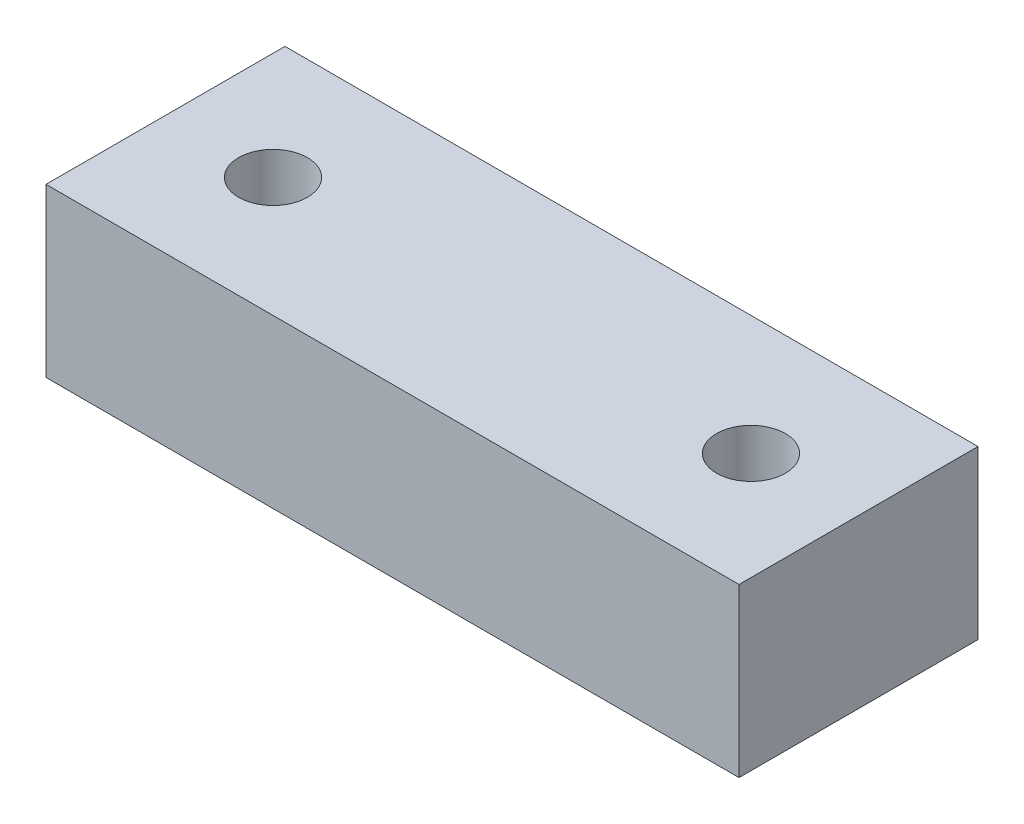
from build123d import *

# Parameters (mm, degrees)
SKETCH1_W                   = 36.83
SKETCH1_H                   = 12.7
BOSS_EXTRUDE1_DEPTH         = 8.89
F_27_0_144_DIAMETER_HOLE1_D = 3.6576


with BuildPart() as part:
    # Sketch1 → Boss-Extrude1 (new body)
    with BuildSketch(Plane(origin=(0, 0, 0), x_dir=(1, 0, 0), z_dir=(0, 1, 0))):
        with Locations((18.415, -6.35)):
            Rectangle(SKETCH1_W, SKETCH1_H)
    extrude(amount=BOSS_EXTRUDE1_DEPTH)

    # #27 (0.144) Diameter Hole1 (through all)
    with Locations(Plane(origin=(0, 8.89, 0), x_dir=(1, 0, 0), z_dir=(0, 1, 0))):
        with Locations((5.715, -6.35), (31.115, -6.35)):
            Hole(F_27_0_144_DIAMETER_HOLE1_D / 2)


solid = part.part
